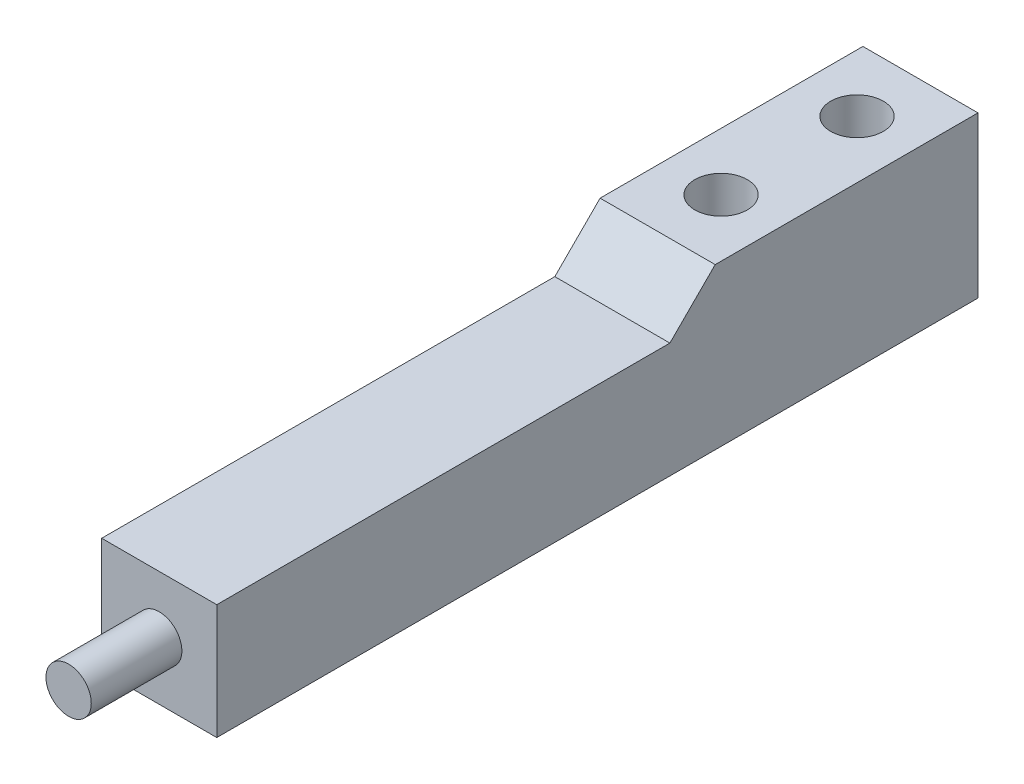
from build123d import *

# Parameters (mm, degrees)
SKETCH2_W                     = 12.7
SKETCH2_H                     = 84
BOSS_EXTRUDE1_DEPTH           = 12.7
SKETCH5_W                     = 12.7
SKETCH5_H                     = 29
BOSS_EXTRUDE2_DEPTH           = 5
CBORE_FOR_M5_SHCS1_AT_2_COUNT = 2
CBORE_FOR_M5_SHCS1_AT_2_PITCH = 15
CHAMFER1_SIZE                 = 5
SKETCH6_R                     = 2.5
BOSS_EXTRUDE3_DEPTH           = 10


with BuildPart() as part:
    # Sketch2 → Boss-Extrude1 (new body)
    with BuildSketch(Plane(origin=(0, 0, 0), x_dir=(1, 0, 0), z_dir=(0, 1, 0))):
        Rectangle(SKETCH2_W, SKETCH2_H)
    extrude(amount=BOSS_EXTRUDE1_DEPTH)

    # Sketch5 → Boss-Extrude2 (add)
    with BuildSketch(Plane(origin=(0, 12.7, 0), x_dir=(1, 0, 0), z_dir=(0, 1, 0))):
        with Locations((0, 27.5)):
            Rectangle(SKETCH5_W, SKETCH5_H)
    extrude(amount=BOSS_EXTRUDE2_DEPTH)

    # Sketch4 → CBORE for M5 SHCS1 (revolve, cut)
    with BuildSketch(Plane(origin=(0, 0, -35), x_dir=(0, 0, -1), z_dir=(1, 0, 0))):
        Polygon((0, 0), (0, 17.7), (2.9, 17.7), (2.9, 5), (5, 5), (5, 0.020977491), (5.025, 0), align=None)
    cbore_for_m5_shcs1 = revolve(axis=Axis((0, -6.35, -35), (0, 1, 0)), mode=Mode.SUBTRACT)

    # CBORE for M5 SHCS1 at 2: CBORE for M5 SHCS1 ×2
    with Locations(*[(0, 0, i * CBORE_FOR_M5_SHCS1_AT_2_PITCH) for i in range(1, CBORE_FOR_M5_SHCS1_AT_2_COUNT)]):
        add(cbore_for_m5_shcs1, mode=Mode.SUBTRACT)

    # Chamfer1
    chamfer1_edges = [part.edges().sort_by_distance(p)[0] for p in [
        (0, 12.7, -13),
    ]]
    chamfer(chamfer1_edges, length=CHAMFER1_SIZE - 0.0001)  # a hair under: the kernel refuses the full size

    # Sketch6 → Boss-Extrude3 (add)
    with BuildSketch(Plane.XY.offset(42)):
        with Locations((0, 6.35)):
            Circle(SKETCH6_R)
    extrude(amount=BOSS_EXTRUDE3_DEPTH)


solid = part.part
